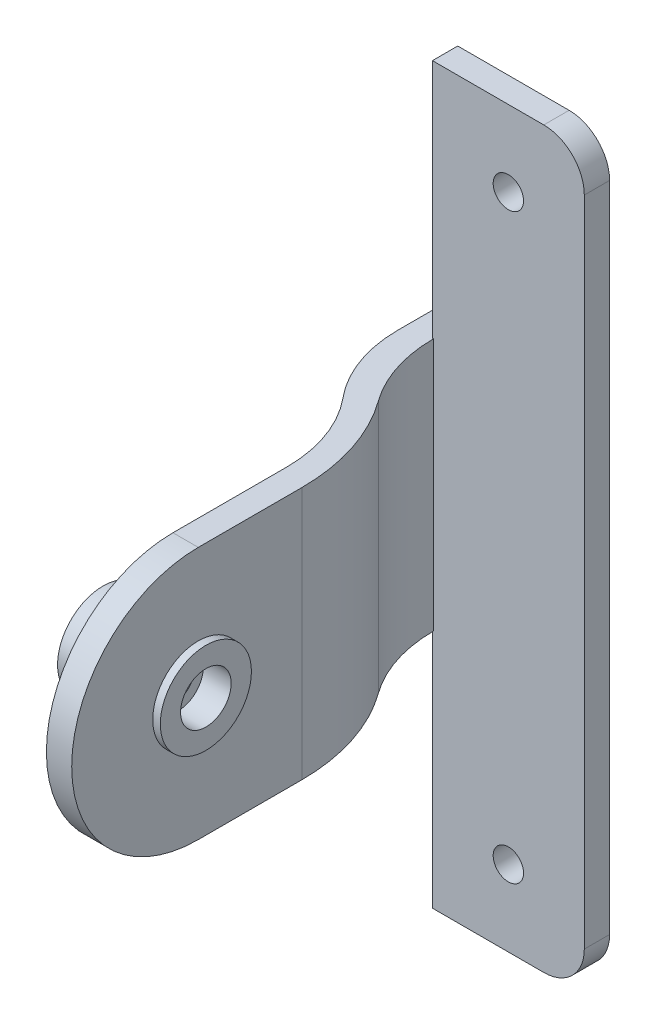
from build123d import *
from build123d.topology import SkipClean

# Parameters (mm, degrees)
SKETCH1_R                = 1.5
BOSS_EXTRUDE1_DEPTH      = 2.5
BOSS_EXTRUDE2_DEPTH      = 6.9
BOSS_EXTRUDE2_DEPTH_BACK = 2.5
SKETCH2_R                = 4.5
SKETCH2_R_2              = 1.5
SKETCH4_R                = 2.5
CUT_EXTRUDE1_DEPTH       = 2
BOSS_EXTRUDE3_START      = 0.75
SKETCH5_R                = 4.5
SKETCH5_R_2              = 2.5
BOSS_EXTRUDE3_DEPTH      = 0.75
BOSS_EXTRUDE4_DEPTH      = 2.5
CUT_EXTRUDE2_REACH       = 80.314
SKETCH7_W                = 7
SKETCH7_H                = 16.5
SKETCH7_W_2              = 16
SKETCH7_H_2              = 8
CUT_EXTRUDE3_REACH       = 82.041
SKETCH9_W                = 2.5
SKETCH9_H                = 22.388822383
BOSS_EXTRUDE5_DEPTH      = 12.5
FILLET2_R                = 1
FILLET3_R                = 4
CUT_EXTRUDE4_DEPTH       = 74.103052287
CUT_EXTRUDE4_DEPTH_BACK  = 74.103052287
SKETCH10_W               = 78.235731334
SKETCH10_H               = 6.290045588
SKETCH11_W               = 14.9
SKETCH11_H               = 2.5
BOSS_EXTRUDE6_DEPTH      = 12.5
BOSS_EXTRUDE7_DEPTH      = 2.5
SKETCH14_R               = 1.5
CUT_EXTRUDE5_DEPTH       = 2.5


with BuildPart() as part:
    # Sketch1 → Boss-Extrude1 (new body)
    with BuildSketch(Plane(origin=(0, 0, 0), x_dir=(0, 0, -1), z_dir=(1, 0, 0))):
        with BuildLine():
            Line((0, 12.5), (34.45, 12.5))
            Line((34.45, 12.5), (34.45, -12.5))
            Line((34.45, -12.5), (0, -12.5))
            ThreePointArc((0, -12.5), (-12.5, 0), (0, 12.5))
        make_face()
        Circle(SKETCH1_R, mode=Mode.SUBTRACT)
    extrude(amount=BOSS_EXTRUDE1_DEPTH)

    # Sketch2 → Boss-Extrude2 (add, two sides: drawn at the far end of the back side and taken through both)
    with BuildSketch(Plane.ZY.offset(-BOSS_EXTRUDE2_DEPTH_BACK)):
        Circle(SKETCH2_R)
        Circle(SKETCH2_R_2, mode=Mode.SUBTRACT)
    extrude(amount=BOSS_EXTRUDE2_DEPTH + BOSS_EXTRUDE2_DEPTH_BACK)

    # Sketch4 → Cut-Extrude1 (cut)
    with BuildSketch(Plane(origin=(2.5, 0, 0), x_dir=(0, 0, -1), z_dir=(1, 0, 0))):
        Circle(SKETCH4_R)
    extrude(amount=-CUT_EXTRUDE1_DEPTH, mode=Mode.SUBTRACT)

    # Sketch5 → Boss-Extrude3 (add)
    with SkipClean():  # the faces are left unmerged after this step: merging them gives an invalid solid
        with BuildSketch(Plane(origin=(2.5, 0, 0), x_dir=(0, 0, -1), z_dir=(1, 0, 0)).offset(BOSS_EXTRUDE3_START)):
            with Locations(Location((0, 0, 0), (0, 0, 180))):
                Circle(SKETCH5_R)
            Circle(SKETCH5_R_2, mode=Mode.SUBTRACT)
        extrude(amount=-BOSS_EXTRUDE3_DEPTH)

    # Sketch6 → Boss-Extrude4 (add)
    with SkipClean():  # the faces are left unmerged after this step: merging them gives an invalid solid
        with BuildSketch(Plane(origin=(0, 0, -34.45), x_dir=(-1, 0, 0), z_dir=(0, 0, -1))):
            Polygon((-8.812505246, 36.25), (53.321583376, 36.25), (53.321583376, -36.25), (6.25, -36.25), (-19.178416624, -36.25), (-19.178416624, 36.25), align=None)
        extrude(amount=-BOSS_EXTRUDE4_DEPTH)
    add(part.part.scale(1), mode=Mode.REPLACE)  # the faces are merged on a copy

    # Sketch7 → Cut-Extrude2 (cut, up to next)
    with BuildSketch(Plane.XY.offset(-31.95), mode=Mode.PRIVATE) as cut_extrude2_sk1:
        with Locations((-1.711858899, -11.632438111)):
            Rectangle(SKETCH7_W, SKETCH7_H)
    cut_extrude2_tool1 = extrude(cut_extrude2_sk1.sketch, amount=-CUT_EXTRUDE2_REACH, mode=Mode.PRIVATE) & part.part
    # Sketch7 → Cut-Extrude2 (cut, up to next)
    with BuildSketch(Plane.XY.offset(-31.95), mode=Mode.PRIVATE) as cut_extrude2_sk2:
        with Locations((-16.5, 0)):
            Rectangle(SKETCH7_W_2, SKETCH7_H_2)
    cut_extrude2_tool2 = extrude(cut_extrude2_sk2.sketch, amount=-CUT_EXTRUDE2_REACH, mode=Mode.PRIVATE) & part.part
    add(cut_extrude2_tool1.solids().sort_by_distance((-1.711859, -11.632438, -31.95))[0], mode=Mode.SUBTRACT)
    add(cut_extrude2_tool2.solids().sort_by_distance((-16.5, 0, -31.95))[0], mode=Mode.SUBTRACT)

    # Sketch9 → Cut-Extrude3 (cut, up to next)
    with BuildSketch(Plane.XZ.offset(12.5), mode=Mode.PRIVATE) as cut_extrude3_sk1:
        with Locations((1.25, -20.755588809)):
            Rectangle(SKETCH9_W, SKETCH9_H)
    cut_extrude3_tool1 = extrude(cut_extrude3_sk1.sketch, amount=-CUT_EXTRUDE3_REACH, mode=Mode.PRIVATE) & part.part
    add(cut_extrude3_tool1.solids().sort_by_distance((1.25, -12.5, -20.755589))[0], mode=Mode.SUBTRACT)


with BuildPart() as cut_extrude3_piece_1:
    # of the separate pieces the step leaves, piece 1, a body of its own (cut_extrude3_pieces)
    add(part.part.solids().sort_by_distance((-53.321583376, 36.25, -31.95))[0])



with BuildPart() as cut_extrude3_piece_2:
    # of the separate pieces the step leaves, piece 2, a body of its own (cut_extrude3_pieces)
    add(part.part.solids().sort_by_distance((0, 12.5, 0))[0])


with BuildPart() as cut_extrude3_piece_1_1:
    add(cut_extrude3_piece_1.part)

    add(cut_extrude3_piece_2.part)  # Boss-Extrude5 merges Cut-Extrude3 piece 2
    # Sketch8 → Boss-Extrude5 (add, symmetric)
    with BuildSketch(Plane(origin=(0, 0, 0), x_dir=(1, 0, 0), z_dir=(0, 1, 0))):
        with BuildLine():
            Line((0, 7.729605828), (2.5, 7.729605828))
            Line((2.5, 7.729605828), (2.5, 10.229605828))
            ThreePointArc((2.5, 10.229605828), (1.573627862, 16.099871922), (-1.115452176, 21.399592472))
            ThreePointArc((-1.115452176, 21.399592472), (-3.053519862, 25.219195088), (-3.721172696, 29.45))
            Line((-3.721172696, 29.45), (-3.721172696, 31.95))
            Line((-3.721172696, 31.95), (-6.221172696, 31.95))
            Line((-6.221172696, 31.95), (-6.221172696, 28.45))
            ThreePointArc((-6.221172696, 28.45), (-5.429444077, 23.92831405), (-3.148463103, 19.944646916))
            ThreePointArc((-3.148463103, 19.944646916), (-0.81124762, 15.862767844), (0, 11.229605828))
            Line((0, 11.229605828), (0, 7.729605828))
        make_face()
    extrude(amount=BOSS_EXTRUDE5_DEPTH, both=True)

    # Fillet2
    fillet2_edges = [cut_extrude3_piece_1_1.edges().sort_by_distance(p)[0] for p in [
        (-8.5, 4, -33.2),
        (-8.5, -4, -33.2),
        (-24.5, -4, -33.2),
        (-24.5, 4, -33.2),
        (-5.211858899, -19.882438111, -33.2),
        (-5.211858899, -3.382438111, -33.2),
        (1.788141101, -3.382438111, -33.2),
        (1.788141101, -19.882438111, -33.2),
    ]]
    fillet(fillet2_edges, radius=FILLET2_R)

    # Fillet3
    fillet3_edges = [cut_extrude3_piece_1_1.edges().sort_by_distance(p)[0] for p in [
        (19.178416624, 36.25, -33.2),
        (-53.321583376, 36.25, -33.2),
        (-53.321583376, -36.25, -33.2),
        (19.178416624, -36.25, -33.2),
    ]]
    fillet(fillet3_edges, radius=FILLET3_R)

    # Sketch10 → Cut-Extrude4 (cut, two sides: drawn at the far end of the back side and taken through both)
    with SkipClean():  # the faces are left unmerged after this step: merging them gives an invalid solid
        with BuildSketch(Plane(origin=(0, 0, 0), x_dir=(1, 0, 0), z_dir=(0, 1, 0)).offset(-CUT_EXTRUDE4_DEPTH_BACK)):
            with Locations((-17.391929865, 35.095022794)):
                Rectangle(SKETCH10_W, SKETCH10_H)
        extrude(amount=CUT_EXTRUDE4_DEPTH + CUT_EXTRUDE4_DEPTH_BACK, mode=Mode.SUBTRACT)

    # Sketch11 → Boss-Extrude6 (add, symmetric)
    with BuildSketch(Plane(origin=(0, 0, 0), x_dir=(1, 0, 0), z_dir=(0, 1, 0))):
        with Locations((3.728827304, 30.7)):
            Rectangle(SKETCH11_W, SKETCH11_H)
    boss_extrude6 = extrude(amount=BOSS_EXTRUDE6_DEPTH, both=True)

    # Sketch13 → Boss-Extrude7 (add)
    with BuildSketch(Plane(origin=(0, 0, -31.95), x_dir=(-1, 0, 0), z_dir=(0, 0, -1))):
        with BuildLine():
            Line((-11.178827304, 12.5), (3.821172696, 12.5))
            Line((3.821172696, 12.5), (3.821172696, 28.75))
            Line((3.821172696, 28.75), (3.821172696, 36.25))
            Line((3.821172696, 36.25), (-3.678827304, 36.25))
            Line((-3.678827304, 36.25), (-7.178827304, 36.25))
            ThreePointArc((-7.178827304, 36.25), (-10.007254429, 35.078427125), (-11.178827304, 32.25))
            Line((-11.178827304, 32.25), (-11.178827304, 28.75))
            Line((-11.178827304, 28.75), (-11.178827304, 12.5))
        make_face()
    boss_extrude7 = extrude(amount=-BOSS_EXTRUDE7_DEPTH)

    # Mirror1: Boss-Extrude6, Boss-Extrude7 across plane
    add(boss_extrude6.mirror(Plane.ZX))
    add(boss_extrude7.mirror(Plane.ZX))

    # Sketch14 → Cut-Extrude5 (cut)
    with BuildSketch(Plane(origin=(0, 0, -31.95), x_dir=(-1, 0, 0), z_dir=(0, 0, -1))):
        with Locations((-3.678827304, 28.75)):
            Circle(SKETCH14_R)
    cut_extrude5 = extrude(amount=-CUT_EXTRUDE5_DEPTH, mode=Mode.SUBTRACT)

    # Mirror2: Cut-Extrude5 across plane
    add(cut_extrude5.mirror(Plane.ZX), mode=Mode.SUBTRACT)


solid = cut_extrude3_piece_1_1.part
